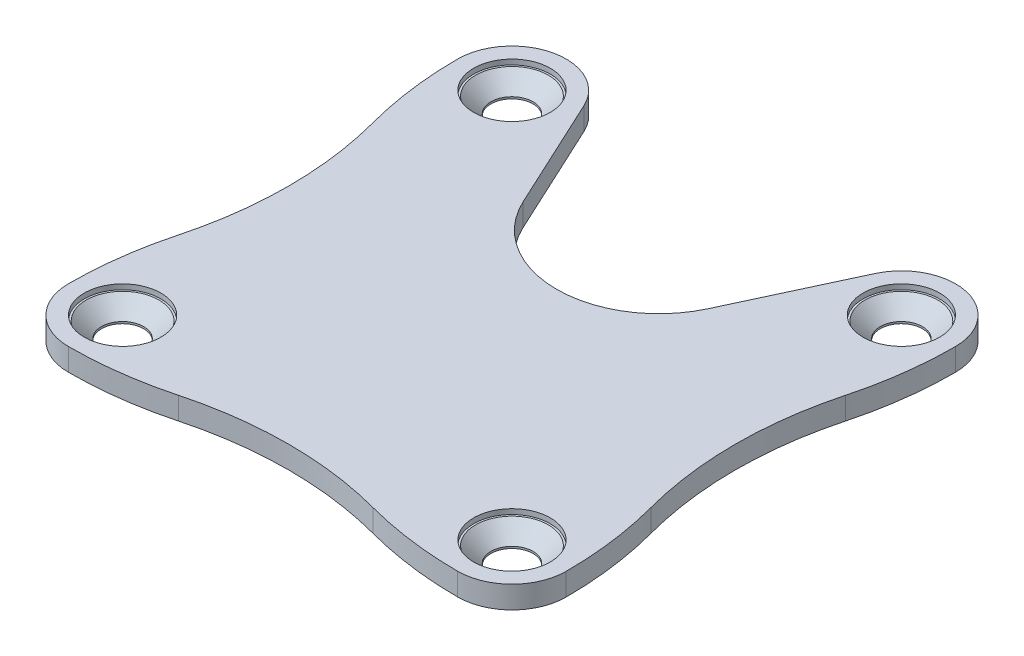
from build123d import *

# Parameters (mm, degrees)
SKETCH1_W                = 39
SKETCH1_H                = 39
SKETCH1_R                = 1.65
SHAPE_DEPTH              = 1.75
CAMERA_CUT_REACH         = 29.633
SKETCH4_R                = 3
SCREW_HEAD_CUTS_DEPTH    = 0.4
SCREW_HEAD_CHAMFERS_SIZE = 1.2
BEAUTY_CUTS_REACH        = 29.633


with BuildPart() as part:
    # Sketch1 → Shape (new body)
    with BuildSketch(Plane(origin=(0, 0, 0), x_dir=(1, 0, 0), z_dir=(0, 1, 0))):
        Rectangle(SKETCH1_W, SKETCH1_H)
        with Locations((-15.25, 15.25)):
            Circle(SKETCH1_R, mode=Mode.SUBTRACT)
        with Locations((15.25, 15.25)):
            Circle(SKETCH1_R, mode=Mode.SUBTRACT)
        with Locations((-15.25, -15.25)):
            Circle(SKETCH1_R, mode=Mode.SUBTRACT)
        with Locations((15.25, -15.25)):
            Circle(SKETCH1_R, mode=Mode.SUBTRACT)
    extrude(amount=SHAPE_DEPTH)

    # Sketch2 → Camera cut (cut, up to next)
    with BuildSketch(Plane(origin=(0, 1.75, 0), x_dir=(1, 0, 0), z_dir=(0, 1, 0)), mode=Mode.PRIVATE) as camera_cut_sk1:
        with BuildLine():
            ThreePointArc((-7.255139017, 8.12910133), (0, 3.5), (7.255139017, 8.12910133))
            Line((7.255139017, 8.12910133), (11.395707531, 17.040790207))
            ThreePointArc((11.395707531, 17.040790207), (12.963994574, 18.83283117), (15.25, 19.5))
            Line((15.25, 19.5), (-15.249999971, 19.5))
            ThreePointArc((-15.249999971, 19.5), (-12.963994499, 18.832831122), (-11.395707469, 17.040790074))
            Line((-11.395707469, 17.040790074), (-7.255139017, 8.12910133))
        make_face()
    camera_cut_tool1 = extrude(camera_cut_sk1.sketch, amount=-CAMERA_CUT_REACH, mode=Mode.PRIVATE) & part.part
    # Sketch2 → Camera cut (cut, up to next)
    with BuildSketch(Plane(origin=(0, 1.75, 0), x_dir=(1, 0, 0), z_dir=(0, 1, 0)), mode=Mode.PRIVATE) as camera_cut_sk2:
        with BuildLine():
            ThreePointArc((-19.5, 15.25), (-18.25520381, 18.25520383), (-15.249999971, 19.5))
            Line((-15.249999971, 19.5), (-19.5, 19.5))
            Line((-19.5, 19.5), (-19.5, 15.25))
        make_face()
    camera_cut_tool2 = extrude(camera_cut_sk2.sketch, amount=-CAMERA_CUT_REACH, mode=Mode.PRIVATE) & part.part
    # Sketch2 → Camera cut (cut, up to next)
    with BuildSketch(Plane(origin=(0, 1.75, 0), x_dir=(1, 0, 0), z_dir=(0, 1, 0)), mode=Mode.PRIVATE) as camera_cut_sk3:
        with BuildLine():
            Line((19.5, 19.5), (15.25, 19.5))
            ThreePointArc((15.25, 19.5), (18.25520382, 18.25520382), (19.5, 15.25))
            Line((19.5, 15.25), (19.5, 19.5))
        make_face()
    camera_cut_tool3 = extrude(camera_cut_sk3.sketch, amount=-CAMERA_CUT_REACH, mode=Mode.PRIVATE) & part.part
    # Sketch2 → Camera cut (cut, up to next)
    with BuildSketch(Plane(origin=(0, 1.75, 0), x_dir=(1, 0, 0), z_dir=(0, 1, 0)), mode=Mode.PRIVATE) as camera_cut_sk4:
        with BuildLine():
            ThreePointArc((-15.25, -19.5), (-18.255203845, -18.255203795), (-19.5, -15.249999928))
            Line((-19.5, -15.249999928), (-19.5, -19.5))
            Line((-19.5, -19.5), (-15.25, -19.5))
        make_face()
    camera_cut_tool4 = extrude(camera_cut_sk4.sketch, amount=-CAMERA_CUT_REACH, mode=Mode.PRIVATE) & part.part
    # Sketch2 → Camera cut (cut, up to next)
    with BuildSketch(Plane(origin=(0, 1.75, 0), x_dir=(1, 0, 0), z_dir=(0, 1, 0)), mode=Mode.PRIVATE) as camera_cut_sk5:
        with BuildLine():
            Line((19.5, -19.5), (19.5, -15.25))
            ThreePointArc((19.5, -15.25), (18.255203817, -18.255203823), (15.249999992, -19.5))
            Line((15.249999992, -19.5), (19.5, -19.5))
        make_face()
    camera_cut_tool5 = extrude(camera_cut_sk5.sketch, amount=-CAMERA_CUT_REACH, mode=Mode.PRIVATE) & part.part
    add(camera_cut_tool1.solids().sort_by_distance((0, 1.75, -12.946988))[0], mode=Mode.SUBTRACT)
    add(camera_cut_tool2.solids().sort_by_distance((-18.550686, 1.75, -18.550686))[0], mode=Mode.SUBTRACT)
    add(camera_cut_tool3.solids().sort_by_distance((18.550686, 1.75, -18.550686))[0], mode=Mode.SUBTRACT)
    add(camera_cut_tool4.solids().sort_by_distance((-18.550686, 1.75, 18.550686))[0], mode=Mode.SUBTRACT)
    add(camera_cut_tool5.solids().sort_by_distance((18.550686, 1.75, 18.550686))[0], mode=Mode.SUBTRACT)

    # Sketch4 → Screw head cuts (cut)
    with BuildSketch(Plane(origin=(0, 1.75, 0), x_dir=(1, 0, 0), z_dir=(0, 1, 0))):
        with Locations((-15.25, 15.25)):
            Circle(SKETCH4_R)
        with Locations((15.25, 15.25)):
            Circle(SKETCH4_R)
        with Locations((15.25, -15.25)):
            Circle(SKETCH4_R)
        with Locations((-15.25, -15.25)):
            Circle(SKETCH4_R)
    extrude(amount=-SCREW_HEAD_CUTS_DEPTH, mode=Mode.SUBTRACT)

    # Screw head chamfers
    screw_head_chamfers_edges = [part.edges().sort_by_distance(p)[0] for p in [
        (-16.9, 1.35, 15.25),
        (13.6, 1.35, 15.25),
        (13.6, 1.35, -15.25),
        (-16.9, 1.35, -15.25),
    ]]
    chamfer(screw_head_chamfers_edges, length=SCREW_HEAD_CHAMFERS_SIZE)

    # Sketch5 → Beauty cuts (cut, up to next)
    with BuildSketch(Plane(origin=(0, 1.75, 0), x_dir=(1, 0, 0), z_dir=(0, 1, 0)), mode=Mode.PRIVATE) as beauty_cuts_sk1:
        with BuildLine():
            Line((-19.5, 15.25), (-19.5, -15.25))
            ThreePointArc((-19.5, -15.25), (-19.248934167, -11.404852896), (-18.5, -7.625))
            ThreePointArc((-18.5, -7.625), (-17.5, 0), (-18.5, 7.625))
            ThreePointArc((-18.5, 7.625), (-19.248934167, 11.404852896), (-19.5, 15.25))
        make_face()
    beauty_cuts_tool1 = extrude(beauty_cuts_sk1.sketch, amount=-BEAUTY_CUTS_REACH, mode=Mode.PRIVATE) & part.part
    # Sketch5 → Beauty cuts (cut, up to next)
    with BuildSketch(Plane(origin=(0, 1.75, 0), x_dir=(1, 0, 0), z_dir=(0, 1, 0)), mode=Mode.PRIVATE) as beauty_cuts_sk2:
        with BuildLine():
            Line((-15.25, -19.5), (15.25, -19.5))
            ThreePointArc((15.25, -19.5), (11.404852896, -19.248934167), (7.625, -18.5))
            ThreePointArc((7.625, -18.5), (0, -17.5), (-7.625, -18.5))
            ThreePointArc((-7.625, -18.5), (-11.404852896, -19.248934167), (-15.25, -19.5))
        make_face()
    beauty_cuts_tool2 = extrude(beauty_cuts_sk2.sketch, amount=-BEAUTY_CUTS_REACH, mode=Mode.PRIVATE) & part.part
    # Sketch5 → Beauty cuts (cut, up to next)
    with BuildSketch(Plane(origin=(0, 1.75, 0), x_dir=(1, 0, 0), z_dir=(0, 1, 0)), mode=Mode.PRIVATE) as beauty_cuts_sk3:
        with BuildLine():
            Line((19.5, -15.25), (19.5, 15.25))
            ThreePointArc((19.5, 15.25), (19.248934167, 11.404852896), (18.5, 7.625))
            ThreePointArc((18.5, 7.625), (17.5, 0), (18.5, -7.625))
            ThreePointArc((18.5, -7.625), (19.248934167, -11.404852896), (19.5, -15.25))
        make_face()
    beauty_cuts_tool3 = extrude(beauty_cuts_sk3.sketch, amount=-BEAUTY_CUTS_REACH, mode=Mode.PRIVATE) & part.part
    add(beauty_cuts_tool1.solids().sort_by_distance((-18.732027, 1.75, 0))[0], mode=Mode.SUBTRACT)
    add(beauty_cuts_tool2.solids().sort_by_distance((0, 1.75, 18.732027))[0], mode=Mode.SUBTRACT)
    add(beauty_cuts_tool3.solids().sort_by_distance((18.732027, 1.75, 0))[0], mode=Mode.SUBTRACT)


solid = part.part
